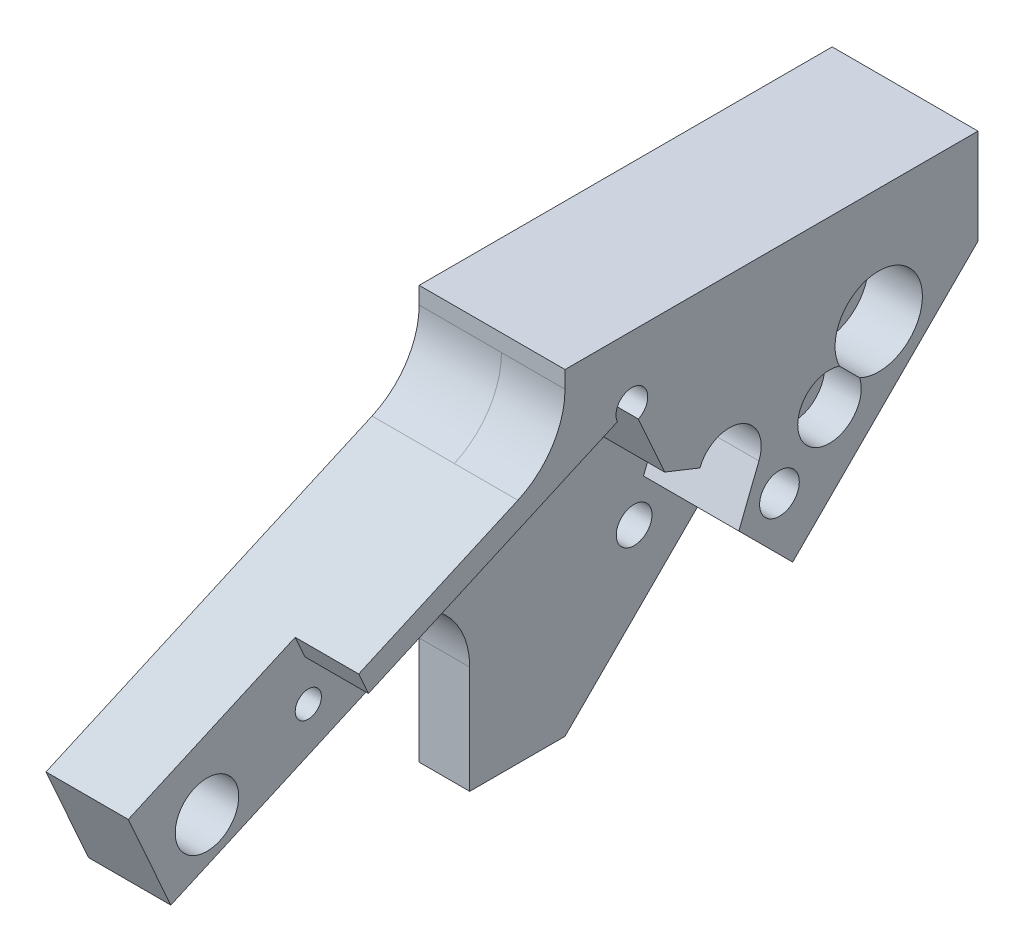
from build123d import *
from OCP.BRepAlgoAPI import BRepAlgoAPI_Cut
from OCP.TopTools import TopTools_ListOfShape

# Parameters (mm, degrees)
SKETCH_1_W                  = 50
SKETCH_1_H                  = 50
EXTRUDE_1_DEPTH             = 15.363798586
EXTRUDE_2_DEPTH             = 3
EXTRUDE_2_DEPTH_BACK        = 15.363799
SKETCH_3_R                  = 1
CUT_EXTRUDE_1_DEPTH         = 3
HOLE_WIZARD_M6_1_D          = 5
HOLE_WIZARD_2_D             = 4.5
HOLE_WIZARD_2_CBORE_D       = 8
HOLE_WIZARD_2_CBORE_DEPTH   = 4.6
HOLE_WIZARD_2_2_D           = 6.6
HOLE_WIZARD_2_2_CBORE_D     = 11
HOLE_WIZARD_2_2_CBORE_DEPTH = 6.8
CUT_EXTRUDE_2_DEPTH         = 43.370143954
EXTRUDE_3_DEPTH             = 18.363798591
CUT_EXTRUDE_3_DEPTH         = 8
HOLE_WIZARD_M4_1_D          = 3.3
FILLET_1_R                  = 10
EXTRUDE_4_REACH             = 79.264
CUT_EXTRUDE_6_DEPTH         = 80.437872908
SKETCH_18_W                 = 10.924413006
SKETCH_18_H                 = 26.794832497
CUT_EXTRUDE_8_DEPTH         = 80.600281663
CUT_EXTRUDE_9_DEPTH         = 3.4
CUT_EXTRUDE_11_DEPTH        = 4
CUT_EXTRUDE_12_REACH        = 82.871
CUT_EXTRUDE_13_DEPTH        = 4
EXTRUDE_7_REACH             = 68.474
FILLET_2_R                  = 10
EXTRUDE_8_DEPTH             = 8
SKETCH_27_R                 = 2.000000006
CUT_EXTRUDE_14_DEPTH        = 8
HOLE_WIZARD_4_D             = 4.5
HOLE_WIZARD_4_CBORE_D       = 8
HOLE_WIZARD_4_CBORE_DEPTH   = 6
CUT_EXTRUDE_16_DEPTH        = 8
CUT_EXTRUDE_17_DEPTH        = 20


with BuildPart() as part:
    # 草图1 → 凸台-拉伸1 (new body)
    with BuildSketch(Plane(origin=(0, 0, 0), x_dir=(0, 0, -1), z_dir=(1, 0, 0))):
        Rectangle(SKETCH_1_W, SKETCH_1_H)
    extrude(amount=EXTRUDE_1_DEPTH)

    # 草图2 → 凸台-拉伸2 (add, two sides: drawn at the far end of the back side and taken through both)
    with BuildSketch(Plane.ZY.offset(-EXTRUDE_2_DEPTH_BACK)):
        Polygon((25, 25), (25, -25), (27, -25), (27, 27), (-25, 27), (-25, 25), align=None)
    extrude(amount=EXTRUDE_2_DEPTH + EXTRUDE_2_DEPTH_BACK)

    # 草图3 → 切除-拉伸1 (cut)
    with BuildSketch(Plane.ZY.offset(3)):
        with Locations((25, 25)):
            Circle(SKETCH_3_R)
    extrude(amount=-CUT_EXTRUDE_1_DEPTH, mode=Mode.SUBTRACT)

    # M6 螺纹孔1 (through all)
    with Locations(Plane(origin=(15.363798586, 0, -3e-09), x_dir=(1.78e-10, 0, 1.0), z_dir=(1.0, 0, -1.78e-10))):
        with Locations((0, 0)):
            Hole(HOLE_WIZARD_M6_1_D / 2)

    # Hole Wizard 2 (through all)
    with Locations(Plane(origin=(15.363798585, 6.3, -6.300000003), x_dir=(1.78e-10, 0, 1.0), z_dir=(1.0, 0, -1.78e-10))):
        with Locations((0, 0), (12.6, 0), (12.6, 12.6)):
            CounterBoreHole(HOLE_WIZARD_2_D / 2, HOLE_WIZARD_2_CBORE_D / 2, HOLE_WIZARD_2_CBORE_DEPTH)

    # Hole Wizard 2 2 (through all)
    with Locations(Plane(origin=(15.363798584, 12.5, -12.500000003), x_dir=(1.78e-10, 0, 1.0), z_dir=(1.0, 0, -1.78e-10))):
        with Locations((0, 0)):
            CounterBoreHole(HOLE_WIZARD_2_2_D / 2, HOLE_WIZARD_2_2_CBORE_D / 2, HOLE_WIZARD_2_2_CBORE_DEPTH)

    # 草图10 → 切除-拉伸2 (cut, through all)
    with BuildSketch(Plane(origin=(15.363798586, 0, -3e-09), x_dir=(-1.7849582135895822e-10, 0, -1.0), z_dir=(1.0, -1.476971878251353e-15, -1.7849582135895822e-10))):
        Polygon((24.999999997, -25), (24.999999997, 15), (-15.000000003, -25), align=None)
    extrude(amount=-CUT_EXTRUDE_2_DEPTH, mode=Mode.SUBTRACT)

    # 草图11 → 凸台-拉伸3 (add)
    with BuildSketch(Plane(origin=(15.363798586, 0, -3e-09), x_dir=(-1.7849582135895822e-10, 0, -1.0), z_dir=(1.0, -1.476971878251353e-15, -1.7849582135895822e-10))):
        Polygon((-70.025418171, -4.08483629), (-65.892973878, -13.366458139), (-27.000000003, 3.949809487), (-27.000000003, 15.071314076), align=None)
    extrude(amount=-EXTRUDE_3_DEPTH)


with BuildPart() as cut_extrude_3_tool:
    # 草图16 → 切除-拉伸3 (new body)
    with BuildSketch(Plane(origin=(15.363798586, 0, -3e-09), x_dir=(-1.7849582135895822e-10, 0, -1.0), z_dir=(1.0, -1.476971878251353e-15, -1.7849582135895822e-10))):
        Polygon((-70.025418171, -4.08483629), (-65.892973878, -13.366458139), (-14.448874374, 9.53793065), (-18.581318667, 18.819552499), align=None)
    extrude(amount=-CUT_EXTRUDE_3_DEPTH)


with BuildPart() as part_1:
    add(part.part)

    # 切除-拉伸3: cut by cut_extrude_3_tool, with a tolerance
    cut_extrude_3_stock = TopTools_ListOfShape()
    cut_extrude_3_stock.Append(part_1.part.wrapped)
    cut_extrude_3_tools = TopTools_ListOfShape()
    cut_extrude_3_tools.Append(cut_extrude_3_tool.part.wrapped)
    cut_extrude_3_cut = BRepAlgoAPI_Cut()
    cut_extrude_3_cut.SetArguments(cut_extrude_3_stock)
    cut_extrude_3_cut.SetTools(cut_extrude_3_tools)
    cut_extrude_3_cut.SetFuzzyValue(0.00001)
    cut_extrude_3_cut.Build()
    add(Compound.cast(cut_extrude_3_cut.Shape()).solids(), mode=Mode.REPLACE)

    # M4 螺纹孔1 (through all)
    with Locations(Plane(origin=(15.363798596, -1.317924527, 51.321178454), x_dir=(1.78e-10, 0, 1.0), z_dir=(1.0, 0, -1.78e-10))):
        with Locations((0, 0), (-9.165601576, -4.08078874)):
            Hole(HOLE_WIZARD_M4_1_D / 2)

    # 圆角1
    # the kernel refuses this fillet: 10 mm, written as the material it adds along each edge
    with BuildSketch(Plane(origin=(45.860422684, 3.949809487, 26.999999995), x_dir=(-1.4769991523120053e-15, -1.0, -1.5279946496499765e-10), z_dir=(-1.0, 1.476971878251353e-15, 1.7849582135895822e-10))) as fillet_1_piece_1_section:
        with BuildLine():
            CenterArc((FILLET_1_R * 1.53986496356, FILLET_1_R), FILLET_1_R, 156.000000009, 114)
            Line((FILLET_1_R * 0.626319505852, FILLET_1_R * 1.40673664294), (0, 0))
            Line((0, 0), (FILLET_1_R * 1.53986496371, 0))
        make_face()
    fillet_1_piece_1 = extrude(amount=48.860422684, mode=Mode.PRIVATE)
    fillet_1_piece_1 = split(fillet_1_piece_1, bisect_by=Plane(origin=(45.860422684, 3.949809487, 26.999999995), z_dir=(-7.26021404635483e-11, -0.9135454576426073, -0.40673664307578594)), keep=Keep.TOP, mode=Mode.PRIVATE)
    fillet_1_piece_1 = split(fillet_1_piece_1, bisect_by=Plane(origin=(15.363799, 3.949809487, 26.999999995), z_dir=(-1, 0, 0)), keep=Keep.TOP, mode=Mode.PRIVATE)
    fillet_1_piece_1 = split(fillet_1_piece_1, bisect_by=Plane(origin=(7.363798591, 3.949809487, 27.000000001), z_dir=(1.0, -1.476971878251353e-15, -1.7849582135895822e-10)), keep=Keep.TOP, mode=Mode.PRIVATE)
    add(fillet_1_piece_1)
    with BuildSketch(Plane(origin=(7.363798591, 3.949809487, 27.000000001), x_dir=(-1.4769991523120053e-15, -1.0, -1.5279946496499762e-10), z_dir=(-1.0, 1.476971878251353e-15, 1.7849582135895822e-10))) as fillet_1_piece_2_section:
        with BuildLine():
            CenterArc((FILLET_1_R * 1.53986496356, FILLET_1_R), FILLET_1_R, 156.000000009, 114)
            Line((FILLET_1_R * 0.626319505852, FILLET_1_R * 1.40673664294), (0, 0))
            Line((0, 0), (FILLET_1_R * 1.53986496371, 0))
        make_face()
    fillet_1_piece_2 = extrude(amount=10.363798591, mode=Mode.PRIVATE)
    fillet_1_piece_2 = split(fillet_1_piece_2, bisect_by=Plane(origin=(7.363798591, 3.949809487, 27.000000001), z_dir=(-7.26021404635483e-11, -0.9135454576426073, -0.40673664307578594)), keep=Keep.TOP, mode=Mode.PRIVATE)
    add(fillet_1_piece_2)

    # 凸台-拉伸4: up to this face of the body (flat: up to its plane)
    extrude_4_end = Plane(part_1.part.faces().sort_by_distance((-2.999999996, 0.278812164, 45.630218613))[0])
    # 草图13 → 凸台-拉伸4 (add, up to the picked face)
    with BuildSketch(Plane(origin=(15.363798586, 0, -3e-09), x_dir=(-1.7849582135895822e-10, 0, -1.0), z_dir=(1.0, -1.476971878251353e-15, -1.7849582135895822e-10)), mode=Mode.PRIVATE) as extrude_4_sk1:
        Polygon((-70.025418171, -4.08483629), (-65.892973878, -13.366458139), (-68.633610251, -14.586668069), (-73.986264473, -2.564409846), (-37.969592965, 13.471245459), (-36.749383036, 10.730609086), align=None)
    extrude_4_tool1 = split(extrude(extrude_4_sk1.sketch, amount=-EXTRUDE_4_REACH, mode=Mode.PRIVATE), bisect_by=extrude_4_end, keep=Keep.BOTH, mode=Mode.PRIVATE)
    add(extrude_4_tool1.solids().sort_by(Axis((15.363799, 1.333576, 58.228575), (-1.0, 1.476971878251353e-15, 1.7849582135895822e-10)))[0])

    # 草图17 → 切除-拉伸6 (cut, through all)
    with BuildSketch(Plane(origin=(7.363798586, 0, -1e-09), x_dir=(-1.7849580400330225e-10, 0, -1.0), z_dir=(1.0, -1.4453333388205653e-15, -1.7849580400330225e-10))):
        Polygon((-18.581318667, 18.819552499), (-22.223488553, 27), (-27.000000003, 27), (-27.000000001, 15.071314077), align=None)
        Polygon((-65.892973878, -13.366458139), (-68.633610251, -14.586668069), (-74.397031705, -1.641811538), (-71.656395332, -0.421601609), align=None)
    extrude(amount=CUT_EXTRUDE_6_DEPTH, mode=Mode.SUBTRACT)

    # 草图18 → 切除-拉伸8 (cut, through all)
    with BuildSketch(Plane(origin=(1e-09, 13.328829097, 5.934377055), x_dir=(1.0, -6.632535563560462e-11, -2.952995089226133e-11), z_dir=(7.260214046354829e-11, 0.9135454576426073, 0.406736643075786))):
        with Locations((12.826005091, -22.717693905)):
            Rectangle(SKETCH_18_W, SKETCH_18_H)
    extrude(amount=-CUT_EXTRUDE_8_DEPTH, mode=Mode.SUBTRACT)

    # 草图21 → 切除-拉伸9 (cut)
    with BuildSketch(Plane(origin=(10.763798586, 0, -2e-09), x_dir=(-1.7849582135895822e-10, 0, -1.0), z_dir=(1.0, 0, -1.7849582135895822e-10))):
        with BuildLine():
            Line((-8.790851011, -3.170197891), (-8.035128255, -4.867578994))
            ThreePointArc((-8.035128255, -4.867578994), (-4.24452272, -5.384842553), (-6.396531162, -8.547928321))
            Line((-6.396531162, -8.547928321), (-5.640808406, -10.245309423))
            ThreePointArc((-5.640808406, -10.245309423), (-2.645818169, -4.673053428), (-8.790851011, -3.170197891))
        make_face()
    extrude(amount=-CUT_EXTRUDE_9_DEPTH, mode=Mode.SUBTRACT)

    # 草图22 → 切除-拉伸11 (cut)
    with BuildSketch(Plane(origin=(7.363798586, 0, -1e-09), x_dir=(-1.7849580400330225e-10, 0, -1.0), z_dir=(1.0, -1.4453333388205653e-15, -1.7849580400330225e-10))):
        with BuildLine():
            Line((-38.81398009, -1.614742519), (-14.448874374, 9.537930649))
            Line((-14.448874374, 9.537930649), (-3.97862792, -13.978627918))
            Line((-3.97862792, -13.978627918), (-15.000000001, -25))
            Line((-15.000000001, -25), (-27.000000001, -25))
            Line((-27.000000001, -25), (-27.000000001, -11.448840151))
            ThreePointArc((-27.000000001, -11.448840151), (-30.6023364, -3.763145619), (-38.81398009, -1.614742519))
        make_face()
    extrude(amount=-CUT_EXTRUDE_11_DEPTH, mode=Mode.SUBTRACT)

    # 切除-拉伸12: up to this face of the body (flat: up to its plane)
    cut_extrude_12_end = Plane(part_1.part.faces().sort_by_distance((3.36379859, -8.635202304, 18.67291257))[0])
    # 草图23 → 切除-拉伸12 (cut, up to the picked face)
    with BuildSketch(Plane(origin=(15.363798586, 0, -3e-09), x_dir=(-1.7849582135895822e-10, 0, -1.0), z_dir=(1.0, -1.476971878251353e-15, -1.7849582135895822e-10)), mode=Mode.PRIVATE) as cut_extrude_12_sk1:
        Polygon((-14.448874367, 9.53793065), (-6.3, 6.3), (-2.58270226, 4.822942956), (-5.116130862, -1.552916699), (1.665476218, -8.334523779), (-3.978627921, -13.978627918), align=None)
    cut_extrude_12_tool1 = split(extrude(cut_extrude_12_sk1.sketch, amount=-CUT_EXTRUDE_12_REACH, mode=Mode.PRIVATE), bisect_by=cut_extrude_12_end, keep=Keep.BOTH, mode=Mode.PRIVATE)
    add(cut_extrude_12_tool1.solids().sort_by(Axis((15.363799, -1.65036, 6.158342), (-1.0, 1.476971878251353e-15, 1.7849582135895822e-10)))[0], mode=Mode.SUBTRACT)

    # 草图24 → 切除-拉伸13 (cut)
    with BuildSketch(Plane(origin=(10.763798586, 0, -2e-09), x_dir=(-1.7849582135895822e-10, 0, -1.0), z_dir=(1.0, 0, -1.7849582135895822e-10))):
        with BuildLine():
            Line((-10.01729774, 7.777057044), (-8.390979979, 7.130844587))
            ThreePointArc((-8.390979979, 7.130844587), (-5.469155413, 8.390979979), (-4.209020021, 5.469155413))
            Line((-4.209020021, 5.469155413), (-2.58270226, 4.822942956))
            ThreePointArc((-2.58270226, 4.822942956), (-4.822942956, 10.01729774), (-10.01729774, 7.777057044))
        make_face()
    extrude(amount=-CUT_EXTRUDE_13_DEPTH, mode=Mode.SUBTRACT)

    # 凸台-拉伸7: up to this face of the body (flat: up to its plane)
    extrude_7_end = Plane(part_1.part.faces().sort_by_distance((2.181899296, 21.035657038, 27))[0])
    # 草图25 → 凸台-拉伸7 (add, up to the picked face)
    with BuildSketch(Plane(origin=(5e-09, -11.87984186, 26.682561687), x_dir=(-1.0, -6.632387866372851e-11, 1.4896587046669596e-10), z_dir=(-1.630634460720778e-10, 0.4067366430757988, -0.9135454576426015)), mode=Mode.PRIVATE) as extrude_7_sk1:
        Polygon((3.000000005, 24.75021988), (3.000000005, 27.75021988), (-15.363798588, 27.750219878), (-15.363798588, 24.750219878), (-7.363798588, 24.750219879), align=None)
    extrude_7_tool1 = split(extrude(extrude_7_sk1.sketch, amount=EXTRUDE_7_REACH, mode=Mode.PRIVATE), bisect_by=extrude_7_end, keep=Keep.BOTH, mode=Mode.PRIVATE)
    add(extrude_7_tool1.solids().sort_by(Axis((6.181899, 12.100927, 37.359488), (-1.630634460720778e-10, 0.4067366430757988, -0.9135454576426015)))[0])

    # 圆角2
    fillet_2_edges = [part_1.edges().sort_by_distance(p)[0] for p in [
        (2.181899295, 18.355222913, 27),
    ]]
    fillet(fillet_2_edges, radius=FILLET_2_R)

    # 草图26 → 凸台-拉伸8 (add)
    with BuildSketch(Plane(origin=(7.363798586, 0, -1e-09), x_dir=(-1.7849580400330225e-10, 0, -1.0), z_dir=(1.0, -1.4453333388205653e-15, -1.7849580400330225e-10))):
        with BuildLine():
            Line((-27.000000002, 18.355222913), (-27.000000001, 15.071314077))
            Line((-27.000000001, 15.071314077), (-18.58131867, 18.819552492))
            Line((-18.58131867, 18.819552492), (-22.223488553, 27))
            Line((-22.223488553, 27), (-27.000000003, 27))
            Line((-27.000000003, 27), (-27.000000002, 24.849298844))
            ThreePointArc((-27.000000002, 24.849298844), (-28.613294322, 19.402908494), (-32.932633571, 15.713844268))
            Line((-32.932633571, 15.713844268), (-27.000000002, 18.355222913))
        make_face()
    extrude(amount=EXTRUDE_8_DEPTH)

    # 草图27 → 切除-拉伸14 (cut)
    with BuildSketch(Plane(origin=(15.363798586, 0, -3e-09), x_dir=(-1.7849582135895822e-10, 0, -1.0), z_dir=(1.0, -1.476971878251353e-15, -1.7849582135895822e-10))):
        with Locations((-18.581318665, 18.819552494)):
            Circle(SKETCH_27_R)
    extrude(amount=-CUT_EXTRUDE_14_DEPTH, mode=Mode.SUBTRACT)

    # 打孔尺寸(%根据)内六角圆柱头螺钉的类型4 (through all)
    with Locations(Plane(origin=(7.363798598, -7.00003543, 64.083408499), x_dir=(1.78e-10, 0, 1.0), z_dir=(1.0, 0, -1.78e-10))):
        with Locations((0, 0)):
            CounterBoreHole(HOLE_WIZARD_4_D / 2, HOLE_WIZARD_4_CBORE_D / 2, HOLE_WIZARD_4_CBORE_DEPTH)

    # 草图31 → 切除-拉伸16 (cut)
    with BuildSketch(Plane(origin=(15.363798586, 0, -3e-09), x_dir=(-1.7849582135895822e-10, 0, -1.0), z_dir=(1.0, -1.476971878251353e-15, -1.7849582135895822e-10))):
        with BuildLine():
            Line((-38.813980091, -1.614742519), (-38.927171891, -1.360509573))
            Line((-38.927171891, -1.360509573), (-41.067366433, -2.313385575))
            ThreePointArc((-41.067366433, -2.313385575), (-39.961348471, -1.897378732), (-38.813980091, -1.614742519))
        make_face()
    extrude(amount=-CUT_EXTRUDE_16_DEPTH, mode=Mode.SUBTRACT)

    # 草图32 → 切除-拉伸17 (cut)
    with BuildSketch(Plane(origin=(1.1e-08, -26.695287236, 59.958596822), x_dir=(1.0, 6.632387744895951e-11, -1.4896586773827423e-10), z_dir=(1.6306344308544944e-10, -0.40673664307581253, 0.9135454576425954))):
        Polygon((15.363798588, 24.750219878), (15.363798606, 27.750219878), (7.363798588, 27.750219879), (7.363798588, 24.750219879), align=None)
    extrude(amount=-CUT_EXTRUDE_17_DEPTH, mode=Mode.SUBTRACT)


solid = part_1.part
